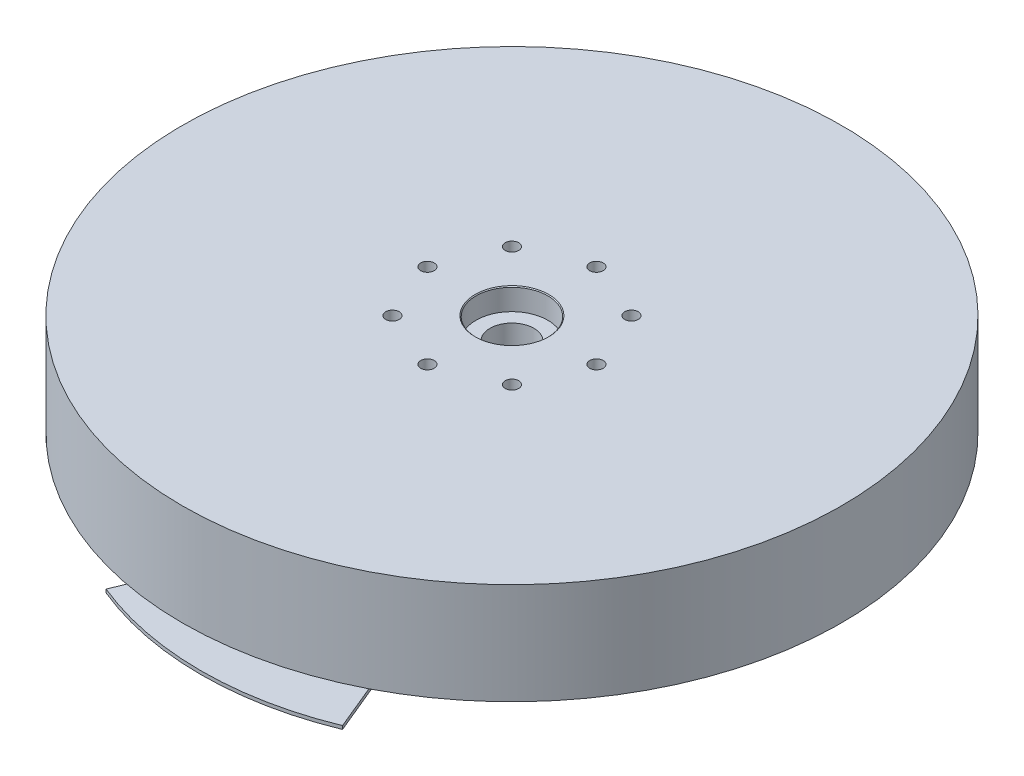
from build123d import *

# Parameters (mm, degrees)
CUT_EXTRUDE1_DEPTH      = 286.527581855
CUT_EXTRUDE1_DEPTH_BACK = 286.527581855
SKETCH2_R               = 4
BOSS_EXTRUDE1_START     = 30
SKETCH5_R               = 74.5
SKETCH5_R_2             = 4
SKETCH5_R_3             = 13
BOSS_EXTRUDE1_DEPTH     = 1
SKETCH6_R               = 74.5
CUT_EXTRUDE4_DEPTH      = 2.5
BOSS_EXTRUDE3_START     = 0.01
SKETCH7_R               = 2.6
BOSS_EXTRUDE3_DEPTH     = 5
SKETCH8_R               = 2.6
BOSS_EXTRUDE4_DEPTH     = 5
CHAMFER3_SIZE           = 3.5
CHAMFER4_SIZE           = 3.5
SKETCH9_R               = 2.6
CUT_EXTRUDE5_DEPTH      = 15
CUT_EXTRUDE6_DEPTH      = 10
CIRPATTERN5_COUNT       = 4
BOSS_EXTRUDE5_START     = 30
BOSS_EXTRUDE5_DEPTH     = 2
CUT_EXTRUDE7_START      = -20
SKETCH12_R              = 22.5
SKETCH12_R_2            = 13
CUT_EXTRUDE7_DEPTH      = 20
CHAMFER7_SIZE           = 1.5
THREAD2_PITCH           = 1.5
THREAD2_TO              = 28.5


with BuildPart() as part:
    # Sketch1 → Revolve1 (revolve)
    with BuildSketch(Plane(origin=(0, 0, 0), x_dir=(0, 0, -1), z_dir=(1, 0, 0))):
        Polygon((-195, 60), (-195, 0), (-185.5, 0), (-185.5, 10), (-74.5, 10), (-74.5, 0), (-74.5, -14), (-15.5, -14), (-13, -11.5), (-13, 47), (-21.25, 47), (-21.25, 59.5), (-21.75, 60), (-74.5, 60), (-185.5, 60), align=None)
    revolve(axis=Axis((0, -14, 0), (0, -1, 0)))

    # Sketch2 → Cut-Extrude1 (cut, two sides: drawn at the far end of the back side and taken through both)
    with BuildSketch(Plane(origin=(0, 60, 0), x_dir=(1, 0, 0), z_dir=(0, 1, 0)).offset(-CUT_EXTRUDE1_DEPTH_BACK)):
        with Locations(Location((-50, 0, 0), (0, 0, 270))):
            Circle(SKETCH2_R)
        with Locations(Location((-35.355339059, 35.355339059, 0), (0, 0, 270))):
            Circle(SKETCH2_R)
        with Locations(Location((0, 50, 0), (0, 0, 270))):
            Circle(SKETCH2_R)
        with Locations(Location((35.355339059, 35.355339059, 0), (0, 0, 270))):
            Circle(SKETCH2_R)
        with Locations(Location((50, 0, 0), (0, 0, 270))):
            Circle(SKETCH2_R)
        with Locations(Location((35.355339059, -35.355339059, 0), (0, 0, 270))):
            Circle(SKETCH2_R)
        with Locations(Location((0, -50, 0), (0, 0, 270))):
            Circle(SKETCH2_R)
        with Locations(Location((-35.355339059, -35.355339059, 0), (0, 0, 270))):
            Circle(SKETCH2_R)
    extrude(amount=CUT_EXTRUDE1_DEPTH + CUT_EXTRUDE1_DEPTH_BACK, mode=Mode.SUBTRACT)

    # Sketch6 → Cut-Extrude4 (cut)
    with BuildSketch(Plane.XZ.offset(14)):
        with Locations(Location((0, 0, 0), (0, 0, 270))):
            Circle(SKETCH6_R)
    extrude(amount=-CUT_EXTRUDE4_DEPTH, mode=Mode.SUBTRACT)

    # Sketch9 → Cut-Extrude5 (cut)
    with BuildSketch(Plane.XZ.offset(-10)):
        with Locations(Location((0, 157, 0), (0, 0, 270))):
            Circle(SKETCH9_R)
        with Locations(Location((0, 102, 0), (0, 0, 270))):
            Circle(SKETCH9_R)
        with Locations(Location((111.015764646, 111.015764646, 0), (0, 0, 270))):
            Circle(SKETCH9_R)
        with Locations(Location((72.124891681, 72.124891681, 0), (0, 0, 270))):
            Circle(SKETCH9_R)
        with Locations(Location((157, 0, 0), (0, 0, 270))):
            Circle(SKETCH9_R)
        with Locations(Location((102, 0, 0), (0, 0, 270))):
            Circle(SKETCH9_R)
        with Locations(Location((111.015764646, -111.015764646, 0), (0, 0, 270))):
            Circle(SKETCH9_R)
        with Locations(Location((72.124891681, -72.124891681, 0), (0, 0, 270))):
            Circle(SKETCH9_R)
        with Locations(Location((0, -157, 0), (0, 0, 270))):
            Circle(SKETCH9_R)
        with Locations(Location((0, -102, 0), (0, 0, 270))):
            Circle(SKETCH9_R)
        with Locations(Location((-111.015764646, -111.015764646, 0), (0, 0, 270))):
            Circle(SKETCH9_R)
        with Locations(Location((-72.124891681, -72.124891681, 0), (0, 0, 270))):
            Circle(SKETCH9_R)
        with Locations(Location((-157, 0, 0), (0, 0, 270))):
            Circle(SKETCH9_R)
        with Locations(Location((-102, 0, 0), (0, 0, 270))):
            Circle(SKETCH9_R)
        with Locations(Location((-111.015764646, 111.015764646, 0), (0, 0, 270))):
            Circle(SKETCH9_R)
        with Locations(Location((-72.124891681, 72.124891681, 0), (0, 0, 270))):
            Circle(SKETCH9_R)
    extrude(amount=-CUT_EXTRUDE5_DEPTH, mode=Mode.SUBTRACT)

    # Sketch12 → Cut-Extrude7 (cut)
    with BuildSketch(Plane.XZ.offset(11.5).offset(CUT_EXTRUDE7_START)):
        with Locations(Location((0, 0, 0), (0, 0, 270))):
            Circle(SKETCH12_R)
        with Locations(Location((0, 0, 0), (0, 0, 270))):
            Circle(SKETCH12_R_2, mode=Mode.SUBTRACT)
    extrude(amount=CUT_EXTRUDE7_DEPTH, mode=Mode.SUBTRACT)

    # Chamfer7
    chamfer7_edges = [part.edges().sort_by_distance(p)[0] for p in [
        (0, -11.5, 22.5),
    ]]
    chamfer(chamfer7_edges, length=CHAMFER7_SIZE)

    # Thread2: arcs per turn and ends read off the stored shape
    # Thread2: the profile of Thread Profile3 profile screwed along a right-hand helix through 19 turns, 8 arcs to a turn; built about Z, then put on its axis
    thread2_z = Axis((0, 0, 0), (0, 0, 1))
    thread2_corners = [(22.4997, 0, -0.000173205), (23.311898813, 0, 0.468749998), (23.311898813, 0, 0.656249998), (22.4997, 0, 1.125173201)]
    with BuildLine(mode=Mode.PRIVATE) as thread2_profile:
        Line(thread2_corners[0], thread2_corners[1])
        Line(thread2_corners[1], thread2_corners[2])
        Line(thread2_corners[2], thread2_corners[3])
        Line(thread2_corners[3], thread2_corners[0])
    thread2_cap = Face(thread2_profile.wire())
    thread2_turn_angles = [0, 22.5, 45, 67.5, 90, 112.5, 135, 157.5, 180, 202.5, 225, 247.5, 270, 292.5, 315, 337.5, 360]
    thread2_turn_weights = [1, 0.9238795325112867, 1, 0.9238795325112867, 1, 0.9238795325112867, 1, 0.9238795325112867, 1, 0.9238795325112867, 1, 0.9238795325112867, 1, 0.9238795325112867, 1, 0.9238795325112867, 1]
    thread2_turn_rails = [Edge.make_bspline([Vector(p[0], p[1], 0).rotate(thread2_z, thread2_turn_angles[k]) / thread2_turn_weights[k] + Vector(0, 0, p[2] + THREAD2_PITCH * thread2_turn_angles[k] / 360) for k in range(17)], [0, 0, 0, 1, 1, 2, 2, 3, 3, 4, 4, 5, 5, 6, 6, 7, 7, 8, 8, 8], 2, thread2_turn_weights) for p in thread2_corners]
    thread2_turn_sides = [Face.make_surface_from_curves(thread2_turn_rails[p[0]], thread2_turn_rails[p[1]]) for p in [(0, 1), (1, 2), (2, 3), (3, 0)]]
    thread2 = Plane(origin=(0, -20, 0), x_dir=(1, 0, 0), z_dir=(0, 1, 0)) * split(Solid(Shell([*[p.moved(Location((0, 0, THREAD2_PITCH * i))) for i in range(19) for p in thread2_turn_sides], thread2_cap, thread2_cap.rotate(thread2_z, 6840).moved(Location((0, 0, THREAD2_PITCH * 6840 / 360)))])), bisect_by=Plane.XY.offset(THREAD2_TO), keep=Keep.BOTTOM, mode=Mode.PRIVATE)
    add(thread2, mode=Mode.SUBTRACT)


with BuildPart() as body_2:
    # Sketch5 → Boss-Extrude1 (new body)
    with BuildSketch(Plane.XZ.offset(14).offset(BOSS_EXTRUDE1_START)):
        with Locations(Location((0, 0, 0), (0, 0, 270))):
            Circle(SKETCH5_R)
        with Locations(Location((35.355339059, -35.355339059, 0), (0, 0, 270))):
            Circle(SKETCH5_R_2, mode=Mode.SUBTRACT)
        with Locations(Location((0, -50, 0), (0, 0, 270))):
            Circle(SKETCH5_R_2, mode=Mode.SUBTRACT)
        with Locations(Location((-35.355339059, -35.355339059, 0), (0, 0, 270))):
            Circle(SKETCH5_R_2, mode=Mode.SUBTRACT)
        with Locations(Location((-50, 0, 0), (0, 0, 270))):
            Circle(SKETCH5_R_2, mode=Mode.SUBTRACT)
        with Locations(Location((50, 0, 0), (0, 0, 270))):
            Circle(SKETCH5_R_2, mode=Mode.SUBTRACT)
        with Locations(Location((35.355339059, 35.355339059, 0), (0, 0, 270))):
            Circle(SKETCH5_R_2, mode=Mode.SUBTRACT)
        with Locations(Location((-35.355339059, 35.355339059, 0), (0, 0, 270))):
            Circle(SKETCH5_R_2, mode=Mode.SUBTRACT)
        with Locations(Location((0, 50, 0), (0, 0, 270))):
            Circle(SKETCH5_R_2, mode=Mode.SUBTRACT)
        with Locations(Location((0, 0, 0), (0, 0, 270))):
            Circle(SKETCH5_R_3, mode=Mode.SUBTRACT)
    extrude(amount=BOSS_EXTRUDE1_DEPTH)


with BuildPart() as body_3:
    # Sketch7 → Boss-Extrude3 (new body)
    with BuildSketch(Plane.XZ.offset(-10).offset(BOSS_EXTRUDE3_START)):
        with BuildLine():
            Line((28.238679848, 69.480766838), (69.951551813, 170.184548062))
            ThreePointArc((69.951551813, 170.184548062), (0, 184), (-69.951551813, 170.184548062))
            Line((-69.951551813, 170.184548062), (-28.238679848, 69.480766838))
            ThreePointArc((-28.238679848, 69.480766838), (0, 75), (28.238679848, 69.480766838))
        make_face()
        with Locations(Location((0, 157, 0), (0, 0, 270))):
            Circle(SKETCH7_R, mode=Mode.SUBTRACT)
        with Locations(Location((0, 102, 0), (0, 0, 90))):
            Circle(SKETCH7_R, mode=Mode.SUBTRACT)
    extrude(amount=BOSS_EXTRUDE3_DEPTH)

    # Chamfer4
    chamfer4_edges = [body_3.edges().sort_by_distance(p)[0] for p in [
        (0, 9.99, 159.6),
        (0, 9.99, 99.4),
    ]]
    chamfer(chamfer4_edges, length=CHAMFER4_SIZE)


with BuildPart() as body_4:
    # Sketch8 → Boss-Extrude4 (new body)
    with BuildSketch(Plane.XZ.offset(-4.99)):
        with BuildLine():
            Line((28.238679848, 69.480766838), (69.951551813, 170.184548062))
            ThreePointArc((69.951551813, 170.184548062), (0, 184), (-69.951551813, 170.184548062))
            Line((-69.951551813, 170.184548062), (-28.238679848, 69.480766838))
            ThreePointArc((-28.238679848, 69.480766838), (0, 75), (28.238679848, 69.480766838))
        make_face()
        with Locations(Location((0, 102, 0), (0, 0, 270))):
            Circle(SKETCH8_R, mode=Mode.SUBTRACT)
        with Locations(Location((0, 157, 0), (0, 0, 270))):
            Circle(SKETCH8_R, mode=Mode.SUBTRACT)
    extrude(amount=BOSS_EXTRUDE4_DEPTH)

    # Chamfer3
    chamfer3_edges = [body_4.edges().sort_by_distance(p)[0] for p in [
        (0, -0.01, 104.6),
        (0, -0.01, 159.6),
    ]]
    chamfer(chamfer3_edges, length=CHAMFER3_SIZE)


with BuildPart() as cut_extrude6_tool:
    # Sketch10 → Cut-Extrude6 (new body)
    with BuildSketch(Plane.XZ.offset(0.01)):
        Polygon((-30.524821078, 75), (30.524821078, 75), (28.238679848, 69.480766838), (-28.238679848, 69.480766838), align=None)
    extrude(amount=-CUT_EXTRUDE6_DEPTH)


with BuildPart() as body_4_1:
    add(body_4.part)

    # Cut-Extrude6: cut by cut_extrude6_tool
    add(cut_extrude6_tool.part, mode=Mode.SUBTRACT)


with BuildPart() as body_3_1:
    add(body_3.part)

    # Cut-Extrude6: cut by cut_extrude6_tool
    add(cut_extrude6_tool.part, mode=Mode.SUBTRACT)


with BuildPart() as cirpattern5_1:
    # CirPattern5: pattern copy
    add(body_4_1.part.rotate(Axis((0, 0, 0), (0, 1, 0)), 1 * 360 / CIRPATTERN5_COUNT))


with BuildPart() as cirpattern5_2:
    # CirPattern5: pattern copy
    add(body_4_1.part.rotate(Axis((0, 0, 0), (0, 1, 0)), 2 * 360 / CIRPATTERN5_COUNT))


with BuildPart() as cirpattern5_3:
    # CirPattern5: pattern copy
    add(body_4_1.part.rotate(Axis((0, 0, 0), (0, 1, 0)), 3 * 360 / CIRPATTERN5_COUNT))


with BuildPart() as cirpattern5_4:
    # CirPattern5: pattern copy
    add(body_3_1.part.rotate(Axis((0, 0, 0), (0, 1, 0)), 1 * 360 / CIRPATTERN5_COUNT))


with BuildPart() as cirpattern5_5:
    # CirPattern5: pattern copy
    add(body_3_1.part.rotate(Axis((0, 0, 0), (0, 1, 0)), 2 * 360 / CIRPATTERN5_COUNT))


with BuildPart() as cirpattern5_6:
    # CirPattern5: pattern copy
    add(body_3_1.part.rotate(Axis((0, 0, 0), (0, 1, 0)), 3 * 360 / CIRPATTERN5_COUNT))


with BuildPart() as body_11:
    # Sketch11 → Boss-Extrude5 (new body)
    with BuildSketch(Plane.XZ.offset(0.01).offset(BOSS_EXTRUDE5_START)):
        with BuildLine():
            Line((-30.524821078, 75), (30.524821078, 75))
            Line((30.524821078, 75), (69.951551813, 170.184548062))
            ThreePointArc((69.951551813, 170.184548062), (0, 184), (-69.951551813, 170.184548062))
            Line((-69.951551813, 170.184548062), (-30.524821078, 75))
        make_face()
    extrude(amount=BOSS_EXTRUDE5_DEPTH)


solid = Compound([part.part, body_2.part, body_4_1.part, body_3_1.part, cirpattern5_1.part, cirpattern5_2.part, cirpattern5_3.part, cirpattern5_4.part, cirpattern5_5.part, cirpattern5_6.part, body_11.part])
